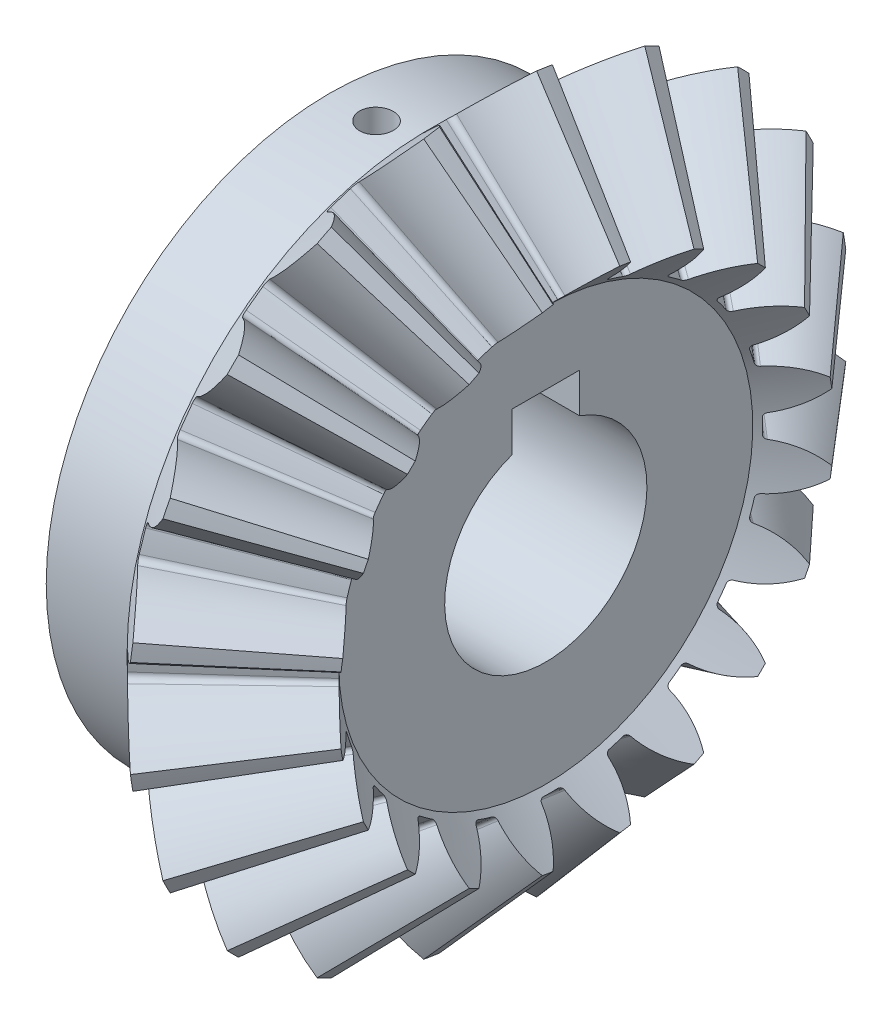
from build123d import *

# Parameters (mm, degrees)
TEETHCUTS_COUNT           = 20
TEETHCUTS_ANGLE           = 342
HUBSKE_R                  = 21
HUB_DEPTH                 = 7.374083791
BORSKE_R                  = 7
BORE_DEPTH                = 35.0000508
KEYSKE_W                  = 5
KEYSKE_H                  = 9.3
KEYWAY_DEPTH              = 35.0000508
SKETCH1_W                 = 5
SKETCH1_H                 = 0.7
CUT_EXTRUDE1_DEPTH        = 41.799524734
M3X0_5_TAPPED_HOLE1_D     = 2.5
M3X0_5_TAPPED_HOLE1_DEPTH = 11


with BuildPart() as part:
    # BasProSke → Base-Revolve (revolve)
    with BuildSketch(Plane(origin=(0, 0, 0), x_dir=(1, 0, 0), z_dir=(0, 1, 0)), mode=Mode.PRIVATE) as base_revolve_sk:
        Polygon((0, 0), (0, 22.373982194), (4.393784766, 26.767766951), (11.687670029, 18.363881673), (8.673337766, 15.349549416), (8.673337766, 0), align=None)
    revolve(base_revolve_sk.sketch.rotate(Axis((-10, 0, 0), (1, 0, 0)), 180), axis=Axis((-10, 0, 0), (1, 0, 0)))

    # ToothCut: read off the stored shape, not the designer's step
    # ToothCut: loft between two sections, ruled curve by curve
    toothcut_from = [
        Edge.make_bspline([(27.632061775, 0.006043964, -0.009393107), (27.627836962, 0.001819151, -0.01483001), (27.622153271, -0.00386454, -0.014024229), (27.618775653, -0.007242158, -0.007509524)], [0, 0, 0, 0, 1, 1, 1, 1], 3, [1, 0.77919554, 0.77919554, 1]),
        Edge.make_bspline([(27.618775653, -0.007242158, 0.007509524), (27.622153271, -0.00386454, 0.014024229), (27.627836962, 0.001819151, 0.01483001), (27.632061775, 0.006043964, 0.009393107)], [0, 0, 0, 0, 1, 1, 1, 1], 3, [1, 0.77919554, 0.77919554, 1]),
        Edge.make_bspline([(27.618775653, -0.007242158, -0.007509524), (27.618275945, -0.007741866, -0.006545694), (27.617876746, -0.008141065, -0.005492289), (27.617585944, -0.008431867, -0.004370125)], [0, 0, 0, 0, 1, 1, 1, 1], 3, [1, 0.993412679, 0.993412679, 1]),
        Edge.make_bspline([(27.617585944, -0.008431867, 0.004370125), (27.617876746, -0.008141065, 0.005492289), (27.618275945, -0.007741866, 0.006545694), (27.618775653, -0.007242158, 0.007509524)], [0, 0, 0, 0, 1, 1, 1, 1], 3, [1, 0.993412679, 0.993412679, 1]),
        Edge.make_bspline([(27.617585944, -0.008431867, -0.004370125), (27.61684697, -0.009170841, -0.001518531), (27.61684697, -0.009170841, 0.001518531), (27.617585944, -0.008431867, 0.004370125)], [0, 0, 0, 0, 1, 1, 1, 1], 3, [1, 0.959287609, 0.959287609, 1]),
        Edge.make_line((27.632061775, 0.006043964, 0.009393107), (27.632061775, 0.006043964, -0.009393107)),
    ]
    toothcut_to = [
        Edge.make_bspline([(4.57837287, 26.952355056, -4.015814914), (3.539433303, 25.91341549, -2.552366841), (2.236900352, 24.610882542, -1.599850731), (0.791930966, 23.165913159, -1.246866219)], [0, 0, 0, 0, 1, 1, 1, 1], 3, [1, 0.968994528, 0.968994528, 1]),
        Edge.make_bspline([(0.791930966, 23.165913159, 1.246866219), (2.236900352, 24.610882542, 1.599850731), (3.539433303, 25.91341549, 2.552366841), (4.57837287, 26.952355056, 4.015814914)], [0, 0, 0, 0, 1, 1, 1, 1], 3, [1, 0.968994528, 0.968994528, 1]),
        Edge.make_bspline([(0.791930966, 23.165913159, -1.246866219), (0.61984468, 22.993826873, -1.204828101), (0.509699618, 22.883681811, -1.013175515), (0.515774885, 22.889757078, -0.766354192)], [0, 0, 0, 0, 1, 1, 1, 1], 3, [1, 0.835734487, 0.835734487, 1]),
        Edge.make_bspline([(0.515774885, 22.889757078, 0.766354192), (0.509699618, 22.883681811, 1.013175515), (0.61984468, 22.993826873, 1.204828101), (0.791930966, 23.165913159, 1.246866219)], [0, 0, 0, 0, 1, 1, 1, 1], 3, [1, 0.835734487, 0.835734487, 1]),
        Edge.make_bspline([(0.515774885, 22.889757078, -0.766354192), (0.528347723, 22.902329916, -0.255554522), (0.528347723, 22.902329916, 0.255554522), (0.515774885, 22.889757078, 0.766354192)], [0, 0, 0, 0, 1, 1, 1, 1], 3, [1, 0.999596466, 0.999596466, 1]),
        Edge.make_line((4.57837287, 26.952355056, 4.015814914), (4.57837287, 26.952355056, -4.015814914)),
    ]
    toothcut = Solid(Shell([*[Face.make_surface_from_curves(toothcut_from[k], toothcut_to[k]) for k in range(6)], Face(Wire(toothcut_from)), Face(Wire(toothcut_to))]))
    add(toothcut, mode=Mode.SUBTRACT)

    # TeethCuts: ToothCut ×20 about axis
    teethcuts_axis = Axis((-10, 0, 0), (1, 0, 0))
    for i in range(1, TEETHCUTS_COUNT):
        add(toothcut.rotate(teethcuts_axis, i * TEETHCUTS_ANGLE / (TEETHCUTS_COUNT - 1)), mode=Mode.SUBTRACT)

    # HubSke → Hub (add)
    with BuildSketch(Plane.ZY):
        with Locations(Location((0, 0, 0), (0, 0, 180))):
            Circle(HUBSKE_R)
    extrude(amount=HUB_DEPTH)

    # BorSke → Bore (cut, symmetric)
    with BuildSketch(Plane(origin=(0, 0, 0), x_dir=(0, 0, -1), z_dir=(1, 0, 0))):
        with Locations(Location((0, 0, 0), (0, 0, 180))):
            Circle(BORSKE_R)
    extrude(amount=BORE_DEPTH, both=True, mode=Mode.SUBTRACT)

    # KeySke → Keyway (cut, symmetric)
    with BuildSketch(Plane(origin=(0, 0, 0), x_dir=(0, 0, -1), z_dir=(1, 0, 0))):
        with Locations((0, 4.65)):
            Rectangle(KEYSKE_W, KEYSKE_H)
    extrude(amount=KEYWAY_DEPTH, both=True, mode=Mode.SUBTRACT)

    # Sketch1 → Cut-Extrude1 (cut, through all)
    with BuildSketch(Plane(origin=(8.673337766, 0, 0), x_dir=(0, 0, -1), z_dir=(1, 0, 0))):
        with BuildLine():
            Line((2.5, 5), (-2.5, 5))
            Line((-2.5, 5), (-2.5, 6.538348415))
            ThreePointArc((-2.5, 6.538348415), (0, -7), (2.5, 6.538348415))
            Line((2.5, 6.538348415), (2.5, 5))
        make_face()
        with BuildLine():
            Line((-2.5, 6.538348415), (-2.5, 5))
            Line((-2.5, 5), (2.5, 5))
            Line((2.5, 5), (2.5, 6.538348415))
            Line((2.5, 6.538348415), (2.5, 7.071067812))
            ThreePointArc((2.5, 7.071067812), (0, 7.5), (-2.5, 7.071067812))
            Line((-2.5, 7.071067812), (-2.5, 6.538348415))
        make_face()
        with Locations((0, 9.65)):
            Rectangle(SKETCH1_W, SKETCH1_H)
        with BuildLine():
            Line((-2.5, 9.3), (-2.5, 7.071067812))
            ThreePointArc((-2.5, 7.071067812), (0, 7.5), (2.5, 7.071067812))
            Line((2.5, 7.071067812), (2.5, 9.3))
            Line((2.5, 9.3), (-2.5, 9.3))
        make_face()
        with BuildLine():
            ThreePointArc((2.5, 6.538348415), (0, -7), (-2.5, 6.538348415))
            Line((-2.5, 6.538348415), (-2.5, 7.071067812))
            ThreePointArc((-2.5, 7.071067812), (-4.330127019, -6.123724357), (7.5, 0))
            ThreePointArc((7.5, 0), (6.123724357, 4.330127019), (2.5, 7.071067812))
            Line((2.5, 7.071067812), (2.5, 6.538348415))
        make_face()
    extrude(amount=-CUT_EXTRUDE1_DEPTH, mode=Mode.SUBTRACT)

    # M3x0.5 Tapped Hole1
    with Locations(Plane(origin=(0, 21, 0), x_dir=(1, 0, 0), z_dir=(0, 1, 0))):
        with Locations((-3.874083791, 0)):
            Hole(M3X0_5_TAPPED_HOLE1_D / 2, depth=M3X0_5_TAPPED_HOLE1_DEPTH)


solid = part.part
